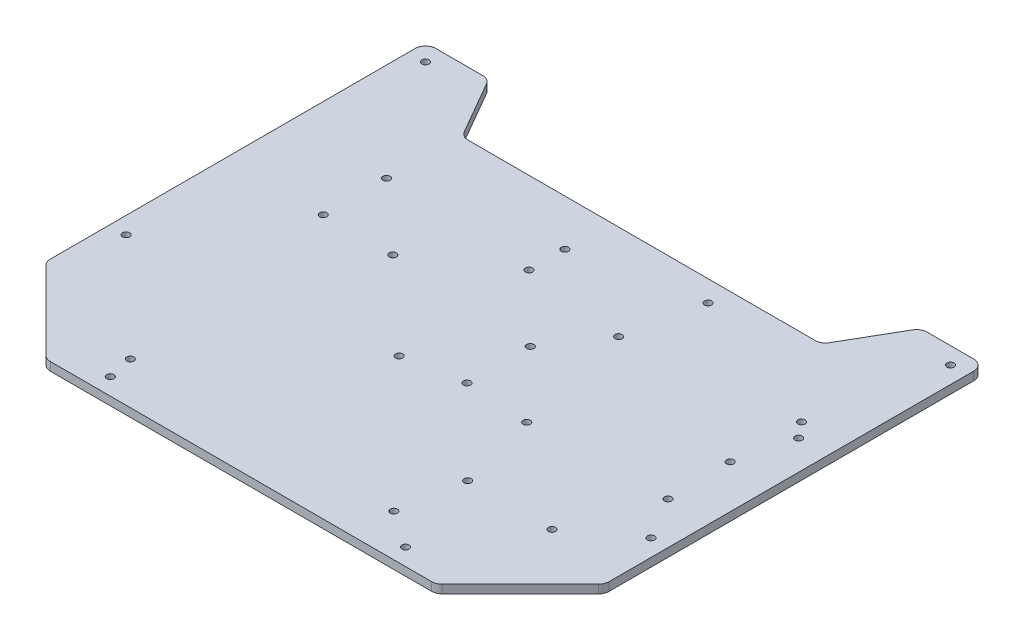
from build123d import *

# Parameters (mm, degrees)
MAIN_EXTRUSION_DEPTH    = 4
CONG_1_R                = 5
ESQUISSE1_R             = 1
ENL_V_MAT_EXTRU_1_DEPTH = 257.850637531
D_GAGEMENT_M31_D        = 3.4
ESQUISSE4_R             = 1
ENL_V_MAT_EXTRU_2_DEPTH = 257.850637531
D_GAGEMENT_M32_D        = 3.4


with BuildPart() as part:
    # Main scetch → Main extrusion (new body)
    with BuildSketch(Plane(origin=(0, 0, 0), x_dir=(1, 0, 0), z_dir=(0, 1, 0))):
        Polygon((-92.5, 0), (92.5, 0), (132.5, 40), (132.5, 220), (102.5, 220), (85.179491924, 190), (-85.179491924, 190), (-102.5, 220), (-132.5, 220), (-132.5, 40), align=None)
    extrude(amount=MAIN_EXTRUSION_DEPTH)

    # Congé1
    cong_1_edges = [part.edges().sort_by_distance(p)[0] for p in [
        (-132.5, 2, -40),
        (-92.5, 2, 0),
        (92.5, 2, 0),
        (132.5, 2, -40),
        (132.5, 2, -220),
        (102.5, 2, -220),
        (85.179491924, 2, -190),
        (-85.179491924, 2, -190),
        (-102.5, 2, -220),
        (-132.5, 2, -220),
    ]]
    fillet(cong_1_edges, radius=CONG_1_R)

    # Esquisse1 → Enlèv. mat.-Extru.1 (cut, through all)
    with BuildSketch(Plane(origin=(0, 4, 0), x_dir=(1, 0, 0), z_dir=(0, 1, 0))):
        with Locations((70, 8)):
            Circle(ESQUISSE1_R)
        with Locations((124.5, 70)):
            Circle(ESQUISSE1_R)
        with Locations((124.5, 212)):
            Circle(ESQUISSE1_R)
        with Locations((-124.5, 212)):
            Circle(ESQUISSE1_R)
        with Locations((-124.5, 70)):
            Circle(ESQUISSE1_R)
        with Locations((-70, 8)):
            Circle(ESQUISSE1_R)
    extrude(amount=-ENL_V_MAT_EXTRU_1_DEPTH, mode=Mode.SUBTRACT)

    # Dégagement M31 (through all)
    with Locations(Plane(origin=(0, 4, 0), x_dir=(1, 0, 0), z_dir=(0, 1, 0))):
        with Locations((-124.5, 212), (-124.5, 70), (-70, 8), (70, 8), (124.5, 70), (124.5, 212)):
            Hole(D_GAGEMENT_M31_D / 2)

    # Esquisse4 → Enlèv. mat.-Extru.2 (cut, through all)
    with BuildSketch(Plane(origin=(0, 4, 0), x_dir=(1, 0, 0), z_dir=(0, 1, 0))):
        with Locations((-86, 125)):
            Circle(ESQUISSE4_R)
        with Locations((-86, 155)):
            Circle(ESQUISSE4_R)
        with Locations((-53, 125)):
            Circle(ESQUISSE4_R)
        with Locations((-14.5, 151.1)):
            Circle(ESQUISSE4_R)
        with Locations((-14.5, 168.1)):
            Circle(ESQUISSE4_R)
        with Locations((41.5, 180)):
            Circle(ESQUISSE4_R)
        with Locations((34.12, 145)):
            Circle(ESQUISSE4_R)
        with Locations((112.5, 153.32)):
            Circle(ESQUISSE4_R)
        with Locations((118.5, 146)):
            Circle(ESQUISSE4_R)
        with Locations((112, 120)):
            Circle(ESQUISSE4_R)
        with Locations((112.5, 90)):
            Circle(ESQUISSE4_R)
        with Locations((17.2, 120)):
            Circle(ESQUISSE4_R)
        with Locations((17.2, 90)):
            Circle(ESQUISSE4_R)
        with Locations((47.5, 88)):
            Circle(ESQUISSE4_R)
        with Locations((57.5, 50)):
            Circle(ESQUISSE4_R)
        with Locations((97.5, 50)):
            Circle(ESQUISSE4_R)
        with Locations((52.5, 20)):
            Circle(ESQUISSE4_R)
        with Locations((-10, 85)):
            Circle(ESQUISSE4_R)
        with Locations((-72.5, 20)):
            Circle(ESQUISSE4_R)
    extrude(amount=-ENL_V_MAT_EXTRU_2_DEPTH, mode=Mode.SUBTRACT)

    # Dégagement M32 (through all)
    with Locations(Plane(origin=(0, 4, 0), x_dir=(1, 0, 0), z_dir=(0, 1, 0))):
        with Locations((-86, 155), (-86, 125), (-53, 125), (17.2, 120), (-14.5, 151.1), (-14.5, 168.1), (34.12, 145), (41.5, 180), (112.5, 153.32), (118.5, 146), (112, 120), (112.5, 90), (47.5, 88), (17.2, 90), (57.5, 50), (97.5, 50), (-10, 85), (-72.5, 20), (52.5, 20)):
            Hole(D_GAGEMENT_M32_D / 2)


solid = part.part
